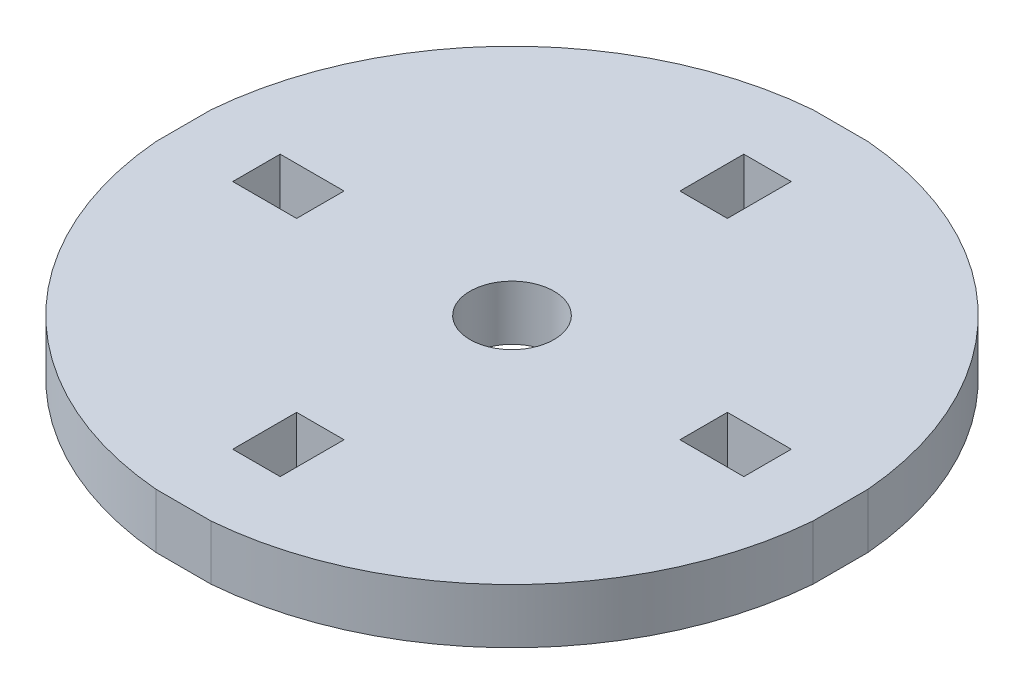
from build123d import *

# Parameters (mm, degrees)
SKETCH1_R           = 2.3
SKETCH1_W           = 2.6
SKETCH1_H           = 3.5
SKETCH1_W_2         = 3.5
SKETCH1_H_2         = 2.6
BOSS_EXTRUDE1_DEPTH = 3


with BuildPart() as part:
    # Sketch1 → Boss-Extrude1 (new body)
    with BuildSketch(Plane(origin=(0, 0, 0), x_dir=(1, 0, 0), z_dir=(0, 1, 0))):
        with BuildLine():
            Line((-1.5, -18), (1.5, -18))
            ThreePointArc((1.5, -18), (12.772039774, -12.772039774), (18, -1.5))
            Line((18, -1.5), (18, 1.5))
            ThreePointArc((18, 1.5), (12.772039774, 12.772039774), (1.5, 18))
            Line((1.5, 18), (-1.5, 18))
            ThreePointArc((-1.5, 18), (-12.772039774, 12.772039774), (-18, 1.5))
            Line((-18, 1.5), (-18, -1.5))
            ThreePointArc((-18, -1.5), (-12.772039774, -12.772039774), (-1.5, -18))
        make_face()
        Circle(SKETCH1_R, mode=Mode.SUBTRACT)
        with Locations((0, -12.25)):
            Rectangle(SKETCH1_W, SKETCH1_H, mode=Mode.SUBTRACT)
        with Locations((-12.25, 0)):
            Rectangle(SKETCH1_W_2, SKETCH1_H_2, mode=Mode.SUBTRACT)
        with Locations((0, 12.25)):
            Rectangle(SKETCH1_W, SKETCH1_H, mode=Mode.SUBTRACT)
        with Locations((12.25, 0)):
            Rectangle(SKETCH1_W_2, SKETCH1_H_2, mode=Mode.SUBTRACT)
    extrude(amount=BOSS_EXTRUDE1_DEPTH)


solid = part.part
